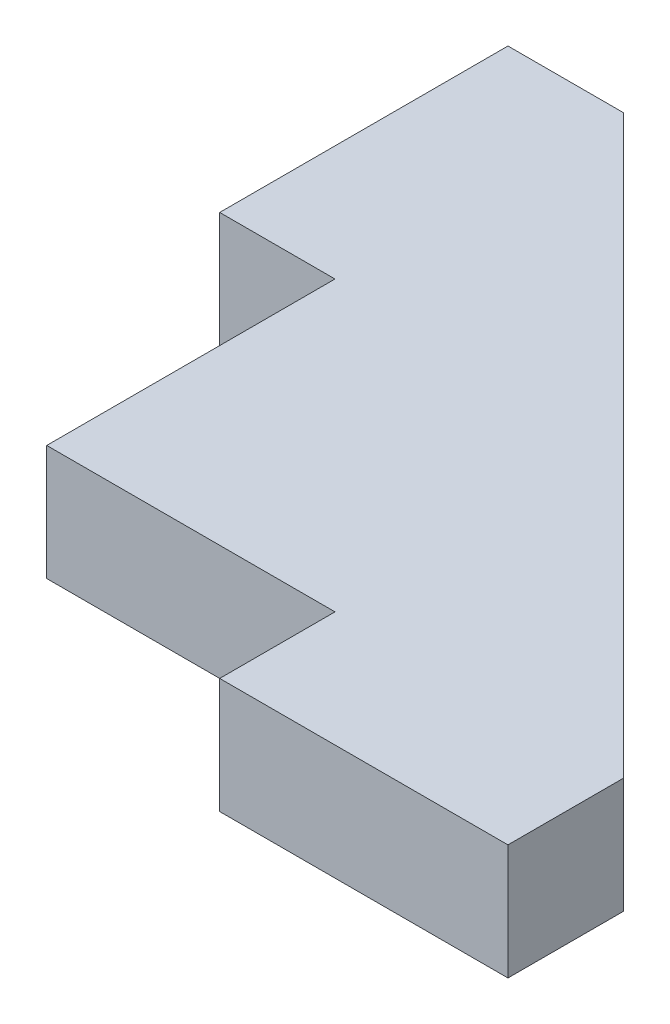
from build123d import *

# Parameters (mm, degrees)
BOSS_EXTRUDE1_DEPTH = 2


with BuildPart() as part:
    # Sketch1 → Boss-Extrude1 (new body)
    with BuildSketch(Plane(origin=(0, 0, 0), x_dir=(1, 0, 0), z_dir=(0, 1, 0))):
        Polygon((0, 5), (0, 0), (5, 0), (5, -2), (10, -2), (10, 0), (0, 10), (-2, 10), (-2, 5), align=None)
    extrude(amount=BOSS_EXTRUDE1_DEPTH)


solid = part.part
